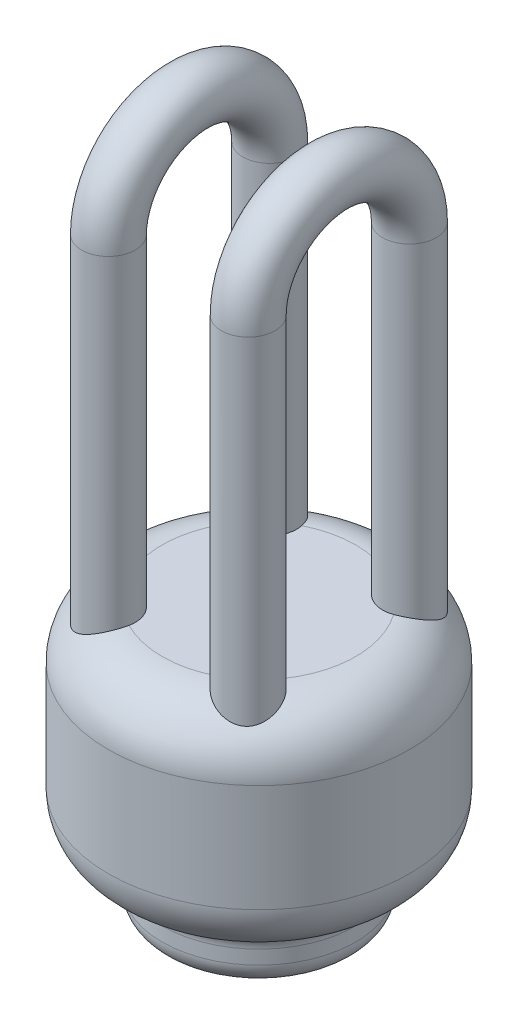
from build123d import *

# Parameters (mm, degrees)
SKETCH_1_R        = 28
EXTRUDE_1_DEPTH   = 40
SWEEP_1_PROFILE_R = 5
SKETCH_13_R       = 18
EXTRUDE_2_DEPTH   = 10
FILLET_1_R        = 10
FILLET_2_R        = 4


with BuildPart() as part:
    # 草图1 → 凸台-拉伸1 (new body)
    with BuildSketch(Plane(origin=(0, 0, 0), x_dir=(1, 0, 0), z_dir=(0, 1, 0))):
        with Locations(Location((0, 0, 0), (0, 0, 270))):
            Circle(SKETCH_1_R)
    extrude(amount=EXTRUDE_1_DEPTH)

    # 扫描1: sweep along a path in 草图2
    with BuildLine(Plane(origin=(13, 0, 0), x_dir=(0, 0, -1), z_dir=(1, 0, 0))) as sweep_1_path:
        Line((15, 40), (15, 100))
        ThreePointArc((15, 100), (0, 115), (-15, 100))
        Line((-15, 100), (-15, 40))
    # 扫描1 profile (on start of the path) → 扫描1 (sweep)
    with BuildSketch(Plane(origin=(13, 40, -15), x_dir=(0, 0, 1), z_dir=(0, 1, 0))):
        Circle(SWEEP_1_PROFILE_R)
    sweep_1 = sweep(path=sweep_1_path.line)

    # 镜向1: 扫描1 across plane
    add(sweep_1.mirror(Plane(origin=(0, 0, 0), x_dir=(0, 0, 1), z_dir=(1, 0, 0))))

    # 草图13 → 凸台-拉伸2 (add)
    with BuildSketch(Plane.XZ):
        with Locations(Location((0, 0, 0), (0, 0, 270))):
            Circle(SKETCH_13_R)
    extrude(amount=EXTRUDE_2_DEPTH)

    # 圆角1
    # the kernel refuses this fillet: 10 mm, written as the material it takes off along each edge
    with BuildSketch(Plane(origin=(0, 0, 0), x_dir=(0, 0, 1), z_dir=(-1, 0, 0))) as fillet_1_piece_1:
        with BuildLine():
            CenterArc((28 - FILLET_1_R, FILLET_1_R), FILLET_1_R, 270, 90)
            Line((28 - FILLET_1_R, 0), (28, 0))
            Line((28, 0), (28, FILLET_1_R))
        make_face()
    revolve(axis=Axis((0, 0, 0), (0, 1, 0)), mode=Mode.SUBTRACT)
    with BuildSketch(Plane(origin=(0, 40, 0), x_dir=(0, 0, 1), z_dir=(-1, 0, 0))) as fillet_1_piece_2_section:
        with BuildLine():
            CenterArc((28 - FILLET_1_R, -FILLET_1_R), FILLET_1_R, 0, 90)
            Line((28 - FILLET_1_R, 0), (28, 0))
            Line((28, 0), (28, -FILLET_1_R))
        make_face()
    fillet_1_piece_2 = revolve(axis=Axis((0, 40, 0), (0, 1, 0)), mode=Mode.PRIVATE)
    fillet_1_piece_2 = fillet_1_piece_2 - Plane(origin=(-13, 37.182499818, 15), x_dir=(0, 0, -1), z_dir=(0, -1, 0)) * Cylinder(5, 112, mode=Mode.PRIVATE)
    fillet_1_piece_2 = fillet_1_piece_2 - Plane(origin=(13, 37.182499818, 15), x_dir=(0, 0, -1), z_dir=(0, -1, 0)) * Cylinder(5, 112, mode=Mode.PRIVATE)
    fillet_1_piece_2 = fillet_1_piece_2 - Plane(origin=(-13, 37.182499818, -15), x_dir=(0, 0, 1), z_dir=(0, 1, 0)) * Cylinder(5, 112, mode=Mode.PRIVATE)
    fillet_1_piece_2 = fillet_1_piece_2 - Plane(origin=(13, 37.182499818, -15), x_dir=(0, 0, 1), z_dir=(0, 1, 0)) * Cylinder(5, 112, mode=Mode.PRIVATE)
    add(fillet_1_piece_2, mode=Mode.SUBTRACT)

    # 圆角2
    fillet_2_edges = [part.edges().sort_by_distance(p)[0] for p in [
        (18, 0, 0),
        (0, -10, 18),
    ]]
    fillet(fillet_2_edges, radius=FILLET_2_R)


solid = part.part
